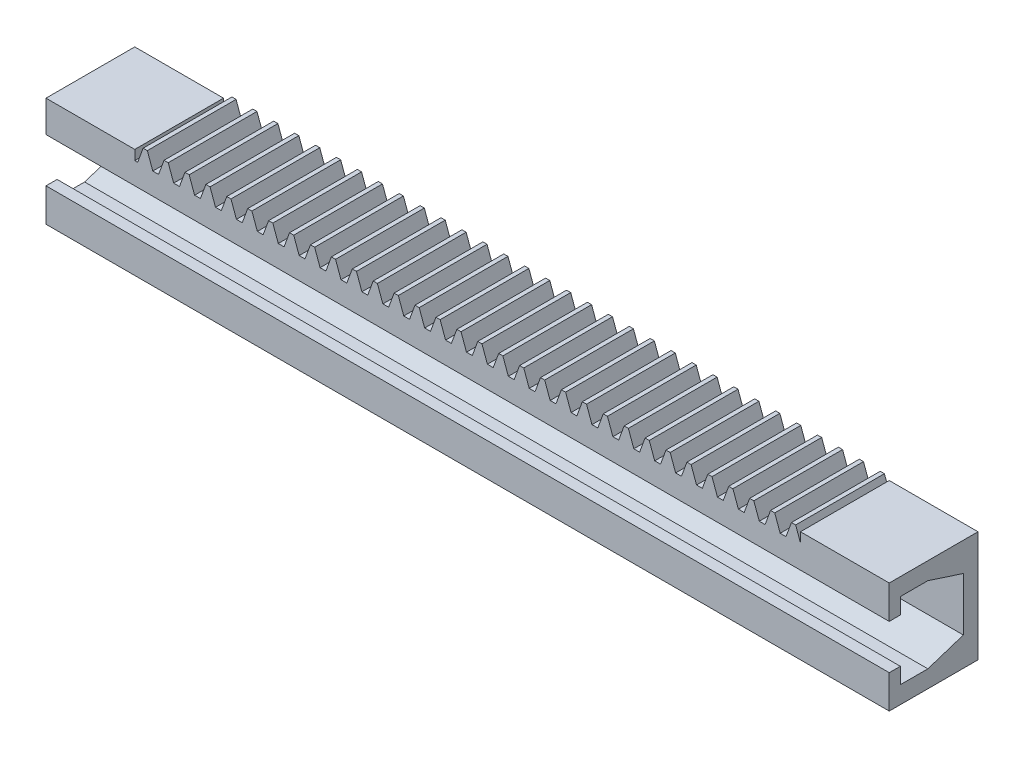
from build123d import *

# Parameters (mm, degrees)
BLANKSKE_W          = 150
BLANKSKE_H          = 11.5
BLANK_DEPTH         = 20
TOOTHCUTSIM_DEPTH   = 152.763796737
TEETHCUTS_COUNT     = 33
TEETHCUTS_PITCH     = 4.712388975
BOSS_EXTRUDE1_DEPTH = 20
BOSS_EXTRUDE2_DEPTH = 20
SKETCH3_W           = 190
SKETCH3_H           = 20
BOSS_EXTRUDE3_DEPTH = 14.285
CUT_EXTRUDE1_DEPTH  = 192.583040024


with BuildPart() as part:
    # BlankSke → Blank (new body)
    with BuildSketch(Plane.XY):
        with Locations((75, 5.75)):
            Rectangle(BLANKSKE_W, BLANKSKE_H)
    extrude(amount=-BLANK_DEPTH)

    # TooCutSkeSim → ToothCutSim (cut, through all)
    with BuildSketch(Plane.XY):
        Polygon((0.654653055, 8.125), (-0.654653055, 8.125), (-1.892297439, 11.5254), (1.892297439, 11.5254), align=None)
    toothcutsim = extrude(amount=-TOOTHCUTSIM_DEPTH, mode=Mode.SUBTRACT)

    # TeethCuts: ToothCutSim ×33
    with Locations(*[(i * TEETHCUTS_PITCH, 0, 0) for i in range(1, TEETHCUTS_COUNT)]):
        add(toothcutsim, mode=Mode.SUBTRACT)

    # Sketch1 → Boss-Extrude1 (add)
    with BuildSketch(Plane(origin=(150, 0, 0), x_dir=(0, 0, -1), z_dir=(1, 0, 0))):
        Polygon((0, 8.514576213), (0, 10.714576213), (20, 10.714576213), (20, 0), (0, 0), align=None)
    extrude(amount=BOSS_EXTRUDE1_DEPTH)

    # Sketch2 → Boss-Extrude2 (add)
    with BuildSketch(Plane.ZY):
        Polygon((-20, 8.125), (-20, 10.325), (0, 10.325), (0, 0), (-20, 0), align=None)
    extrude(amount=BOSS_EXTRUDE2_DEPTH)

    # Sketch3 → Boss-Extrude3 (add)
    with BuildSketch(Plane.XZ):
        with Locations((75, -10)):
            Rectangle(SKETCH3_W, SKETCH3_H)
    extrude(amount=BOSS_EXTRUDE3_DEPTH)

    # Sketch4 → Cut-Extrude1 (cut, through all)
    with BuildSketch(Plane(origin=(170, 0, 0), x_dir=(0, 0, -1), z_dir=(1, 0, 0))):
        Polygon((2.5, -6.785211894), (2.5, -10.385211894), (8.7, -10.385211894), (16.7, -7.785211894), (16.7, -1.785211894), (16.7, 4.214788106), (8.7, 6.814788106), (2.5, 6.814788106), (2.5, 3.214788106), (0, 3.214788106), (0, -1.785211894), (0, -6.785211894), align=None)
    extrude(amount=-CUT_EXTRUDE1_DEPTH, mode=Mode.SUBTRACT)


solid = part.part
